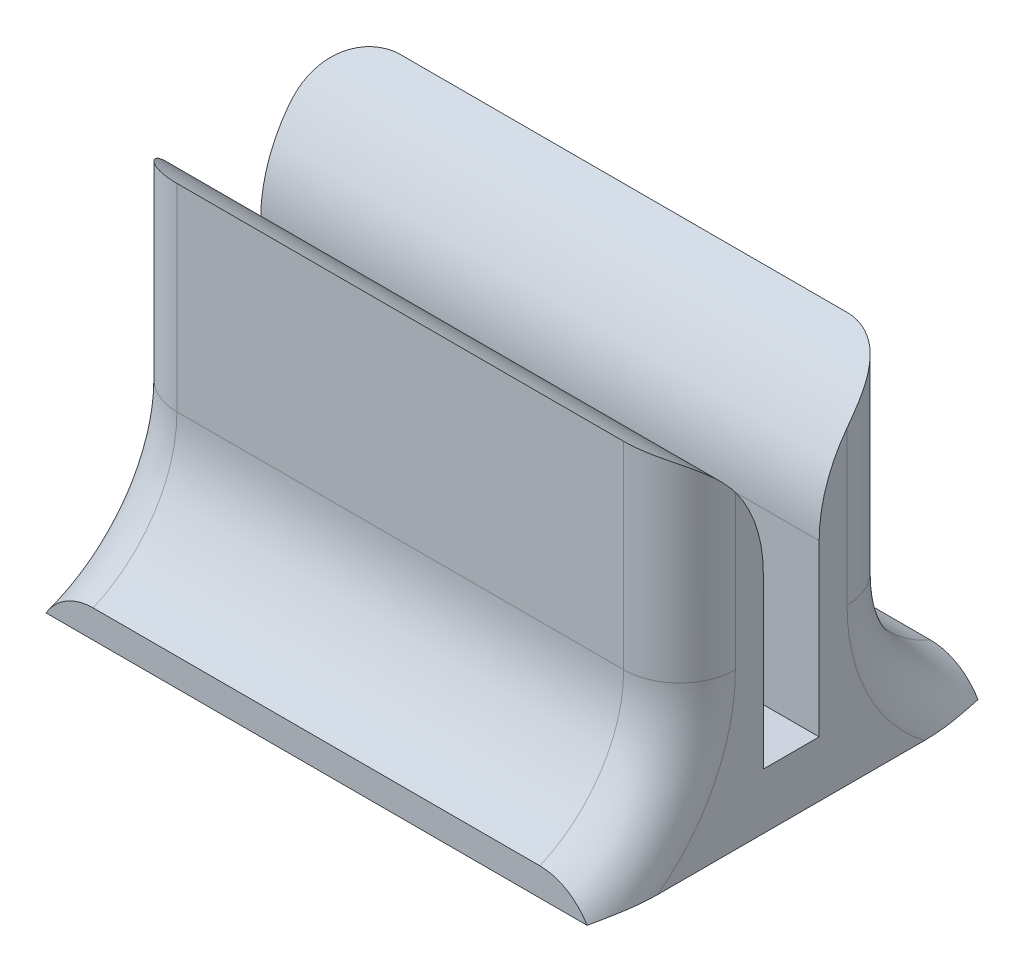
from build123d import *

# Parameters (mm, degrees)
SKETCH2_W           = 100
SKETCH2_H           = 40
BOSS_EXTRUDE1_DEPTH = 10
SKETCH4_W           = 100
SKETCH4_H           = 15
BOSS_EXTRUDE2_DEPTH = 63.33333
FILLET1_R           = 25
FILLET2_R           = 25
SKETCH5_W           = 100
SKETCH5_H           = 15
BOSS_EXTRUDE3_DEPTH = 5
FILLET3_R           = 25
FILLET4_R           = 25
FILLET10_R          = 10
FILLET11_R          = 10


with BuildPart() as part:
    # Sketch2 → Boss-Extrude1 (new body)
    with BuildSketch(Plane(origin=(0, 0, 0), x_dir=(1, 0, 0), z_dir=(0, 1, 0))):
        Rectangle(SKETCH2_W, SKETCH2_H)
    extrude(amount=BOSS_EXTRUDE1_DEPTH)

    # Sketch4 → Boss-Extrude2 (add)
    with BuildSketch(Plane(origin=(0, 0, 0), x_dir=(1, 0, 0), z_dir=(0, 1, 0))):
        with Locations((0, -12.5)):
            Rectangle(SKETCH4_W, SKETCH4_H)
        with Locations((0, 12.5)):
            Rectangle(SKETCH4_W, SKETCH4_H)
    extrude(amount=BOSS_EXTRUDE2_DEPTH)

    # Fillet1
    # the kernel refuses this fillet: 25 mm, written as the material it takes off along each edge
    with BuildSketch(Plane(origin=(107.282196187, 63.33333, 5), x_dir=(0, 0, 1), z_dir=(-1, 0, 0))) as fillet1_piece_1:
        with BuildLine():
            CenterArc((25, -22.912878475), FILLET1_R, 113.578178478, 66.421821522)
            Line((0, -22.912878475), (-0.5, -22.912878475))
            Line((-0.5, -22.912878475), (-0.5, 0))
            Line((-0.5, 0), (0, 0.5))
            ThreePointArc((0, 0.5), (7.5, 0.5), (14.8, 0.458257569))
            Line((14.8, 0.458257569), (15, 0))
        make_face()
    extrude(amount=214.564392374, mode=Mode.SUBTRACT)

    # Fillet2
    # the kernel refuses this fillet: 25 mm, written as the material it takes off along each edge
    with BuildSketch(Plane(origin=(107.282196187, 63.33333, -5), x_dir=(0, 0, -1), z_dir=(-1, 0, 0))) as fillet2_piece_1:
        with BuildLine():
            CenterArc((25, 22.912878475), FILLET2_R, 180, 66.421821522)
            Line((0, 22.912878475), (-0.5, 22.912878475))
            Line((-0.5, 22.912878475), (-0.5, 0))
            Line((-0.5, 0), (0, -0.5))
            ThreePointArc((0, -0.5), (7.5, -0.5), (14.8, -0.458257569))
            Line((14.8, -0.458257569), (15, 0))
        make_face()
    extrude(amount=214.564392374, mode=Mode.SUBTRACT)

    # Sketch5 → Boss-Extrude3 (add)
    with BuildSketch(Plane(origin=(0, 0, 0), x_dir=(1, 0, 0), z_dir=(0, 1, 0))):
        with Locations((0, -27.5)):
            Rectangle(SKETCH5_W, SKETCH5_H)
        with Locations((0, 27.5)):
            Rectangle(SKETCH5_W, SKETCH5_H)
    extrude(amount=BOSS_EXTRUDE3_DEPTH)

    # Fillet3
    # the kernel refuses this fillet: 25 mm, written as the material it adds along each edge
    with BuildSketch(Plane(origin=(-50, 5, 20), x_dir=(0, 1, 0), z_dir=(1, 0, 0))) as fillet3_piece_1:
        with BuildLine():
            CenterArc((22.912878475, 25), FILLET3_R, 203.578178478, 66.421821522)
            Line((0, 15), (-0.458257569, 14.8))
            ThreePointArc((-0.458257569, 14.8), (-0.5, 7.5), (-0.5, 0))
            Line((-0.5, 0), (0, -0.5))
            Line((0, -0.5), (22.912878475, -0.5))
            Line((22.912878475, -0.5), (22.912878475, 0))
        make_face()
    extrude(amount=100)

    # Fillet4
    # the kernel refuses this fillet: 25 mm, written as the material it adds along each edge
    with BuildSketch(Plane(origin=(-50, 5, -20), x_dir=(0, 1, 0), z_dir=(1, 0, 0))) as fillet4_piece_1:
        with BuildLine():
            CenterArc((22.912878475, -25), FILLET4_R, 90, 66.421821522)
            Line((0, -15), (-0.458257569, -14.8))
            ThreePointArc((-0.458257569, -14.8), (-0.5, -7.5), (-0.5, 0))
            Line((-0.5, 0), (0, 0.5))
            Line((0, 0.5), (22.912878475, 0.5))
            Line((22.912878475, 0.5), (22.912878475, 0))
        make_face()
    extrude(amount=100)

    # Fillet10
    fillet10_edges = [part.edges().sort_by_distance(p)[0] for p in [
        (-50, 14.219814537, -24.083499337),
        (-50, 45.623104237, -20),
    ]]
    fillet(fillet10_edges, radius=FILLET10_R)

    # Fillet11
    fillet11_edges = [part.edges().sort_by_distance(p)[0] for p in [
        (50, 14.219814537, -24.083499337),
        (50, 14.219814537, 24.083499337),
        (-50, 14.219814537, 24.083499337),
        (50, 45.623104237, -20),
        (50, 45.623104237, 20),
        (-50, 45.623104237, 20),
    ]]
    fillet(fillet11_edges, radius=FILLET11_R)


solid = part.part
